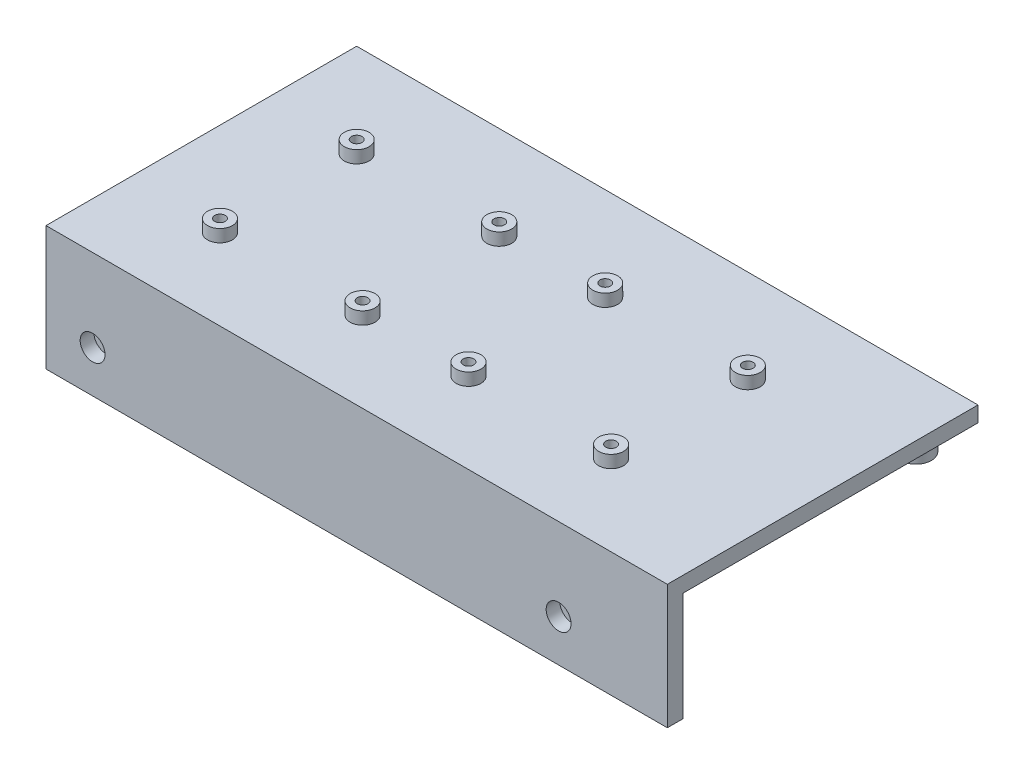
from build123d import *

# Parameters (mm, degrees)
BODY_DEPTH                        = 200
SKETCH4_R                         = 7.5
MOUNTING_NOBS_DEPTH               = 10
SIDE_MOUNTING_HOLES_START         = -10
SIDE_MOUNTING_HOLES_OUTLINE_R     = 2.25
SIDE_MOUNTING_HOLES_DEPTH         = 15
SIDE_MOUNTING_HOLES_START_2       = 0.6
SIDE_MOUNTING_HOLES_2_OUTLINE_R   = 4
SIDE_MOUNTING_HOLES_2_OUTLINE_R_2 = 2.25
SIDE_MOUNTING_HOLES_2_DEPTH       = 4.4
SKETCH8_R                         = 4
DC_DRIVER_NOBS_DEPTH              = 4
DC_DRIVER_MOUNTING_START          = 35
DC_DRIVER_MOUNTING_OUTLINE_R      = 1.7
DC_DRIVER_MOUNTING_DEPTH          = 9
DC_DRIVER_NUT_CUTS_DEPTH          = 2.5
DC_DRIVER_PATTERN_COUNT           = 2
DC_DRIVER_PATTERN_PITCH           = 80
SKETCH13_R                        = 5
SUPPORT_NOBS_DEPTH                = 8


# Read off the part's stored shape, not the designer's step: side_mounting_holes, dc_driver_mounting
with BuildPart() as part:
    # Sketch1 → body (new body)
    with BuildSketch(Plane(origin=(0, 0, 0), x_dir=(0, 0, -1), z_dir=(1, 0, 0))):
        Polygon((0, 0), (0, 35), (95, 35), (95, 40), (-5, 40), (-5, 0), align=None)
    extrude(amount=BODY_DEPTH)

    # Sketch4 → mounting_nobs (add)
    with BuildSketch(Plane(origin=(0, 0, 0), x_dir=(-1, 0, 0), z_dir=(0, 0, -1))):
        with Locations(Location((-165, 13.5, 0), (0, 0, 180))):
            Circle(SKETCH4_R)
        with Locations(Location((-15, 13.5, 0), (0, 0, 180))):
            Circle(SKETCH4_R)
    extrude(amount=MOUNTING_NOBS_DEPTH)

    # side_mounting_holes outline → side_mounting_holes (cut)
    with BuildSketch(Plane.XY.offset(SIDE_MOUNTING_HOLES_START)):
        with Locations((165, 13.5)):
            Circle(SIDE_MOUNTING_HOLES_OUTLINE_R)
        with Locations((15, 13.5)):
            Circle(SIDE_MOUNTING_HOLES_OUTLINE_R)
    extrude(amount=SIDE_MOUNTING_HOLES_DEPTH, mode=Mode.SUBTRACT)

    # side_mounting_holes 2 outline → side_mounting_holes 2 (cut)
    # profile 1 of 2: a face of its own
    with BuildSketch(Plane.XY.offset(SIDE_MOUNTING_HOLES_START_2)):
        with Locations((165, 13.5)):
            Circle(SIDE_MOUNTING_HOLES_2_OUTLINE_R)
        with Locations((165, 13.5)):
            Circle(SIDE_MOUNTING_HOLES_2_OUTLINE_R_2, mode=Mode.SUBTRACT)
    # profile 2 of 2: a face of its own
    with BuildSketch(Plane.XY.offset(SIDE_MOUNTING_HOLES_START_2)):
        with Locations((15, 13.5)):
            Circle(SIDE_MOUNTING_HOLES_2_OUTLINE_R)
        with Locations((15, 13.5)):
            Circle(SIDE_MOUNTING_HOLES_2_OUTLINE_R_2, mode=Mode.SUBTRACT)
    extrude(amount=SIDE_MOUNTING_HOLES_2_DEPTH, mode=Mode.SUBTRACT)

    # Sketch8 → dc_driver_nobs (add)
    with BuildSketch(Plane(origin=(0, 40, 0), x_dir=(1, 0, 0), z_dir=(0, 1, 0))):
        with Locations(Location((30, 65, 0), (0, 0, 90))):
            Circle(SKETCH8_R)
        with Locations(Location((75.9, 65, 0), (0, 0, 90))):
            Circle(SKETCH8_R)
        with Locations(Location((30, 21, 0), (0, 0, 90))):
            Circle(SKETCH8_R)
        with Locations(Location((75.9, 21, 0), (0, 0, 90))):
            Circle(SKETCH8_R)
    dc_driver_nobs = extrude(amount=DC_DRIVER_NOBS_DEPTH)

    # dc_driver_mounting outline → dc_driver_mounting (cut)
    with BuildSketch(Plane(origin=(0, 0, 0), x_dir=(1, 0, 0), z_dir=(0, 1, 0)).offset(DC_DRIVER_MOUNTING_START)):
        with Locations((75.9, 65)):
            Circle(DC_DRIVER_MOUNTING_OUTLINE_R)
        with Locations((30, 21)):
            Circle(DC_DRIVER_MOUNTING_OUTLINE_R)
        with Locations((75.9, 21)):
            Circle(DC_DRIVER_MOUNTING_OUTLINE_R)
        with Locations((30, 65)):
            Circle(DC_DRIVER_MOUNTING_OUTLINE_R)
    dc_driver_mounting = extrude(amount=DC_DRIVER_MOUNTING_DEPTH, mode=Mode.SUBTRACT)

    # Sketch12 → dc_driver_nut_cuts (cut)
    with BuildSketch(Plane.XZ.offset(-35)):
        Polygon((33.117691454, -21), (31.558845727, -18.3), (28.441154273, -18.3), (26.882308546, -21), (28.441154273, -23.7), (31.558845727, -23.7), align=None)
        Polygon((79.017691454, -21), (77.458845727, -18.3), (74.341154273, -18.3), (72.782308546, -21), (74.341154273, -23.7), (77.458845727, -23.7), align=None)
        Polygon((79.017691454, -65), (77.458845727, -62.3), (74.341154273, -62.3), (72.782308546, -65), (74.341154273, -67.7), (77.458845727, -67.7), align=None)
        Polygon((33.117691454, -65), (31.558845727, -62.3), (28.441154273, -62.3), (26.882308546, -65), (28.441154273, -67.7), (31.558845727, -67.7), align=None)
    dc_driver_nut_cuts = extrude(amount=-DC_DRIVER_NUT_CUTS_DEPTH, mode=Mode.SUBTRACT)

    # dc_driver_pattern: dc_driver_nobs, dc_driver_mounting, dc_driver_nut_cuts ×2
    with Locations(*[(i * DC_DRIVER_PATTERN_PITCH, 0, 0) for i in range(1, DC_DRIVER_PATTERN_COUNT)]):
        add(dc_driver_nobs)
        add(dc_driver_mounting, mode=Mode.SUBTRACT)
        add(dc_driver_nut_cuts, mode=Mode.SUBTRACT)

    # Sketch13 → support_nobs (add)
    with BuildSketch(Plane.XZ.offset(-35)):
        with Locations(Location((10, -85, 0), (0, 0, 90))):
            Circle(SKETCH13_R)
        with Locations(Location((190, -85, 0), (0, 0, 90))):
            Circle(SKETCH13_R)
    extrude(amount=SUPPORT_NOBS_DEPTH)


solid = part.part
